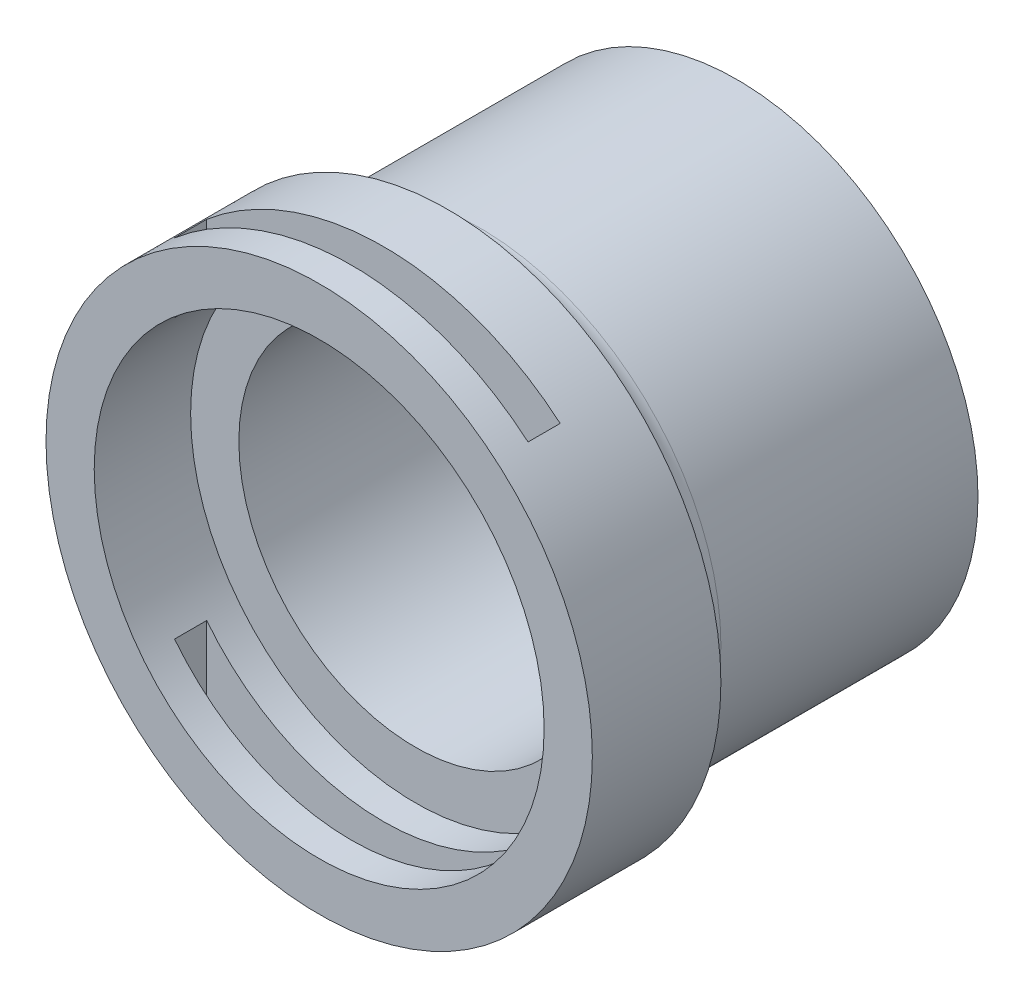
from build123d import *

# Parameters (mm, degrees)
SKETCH1_R                = 15
BOSS_EXTRUDE5_DEPTH      = 26
SKETCH3_R                = 5.625
CUT_EXTRUDE2_DEPTH       = 34.555923471
CUT_EXTRUDE3_DEPTH       = 28
CUT_EXTRUDE3_DEPTH_BACK  = 20
SKETCH4_R                = 11
CUT_EXTRUDE6_START       = 6
SKETCH7_R                = 11
SKETCH7_R_2              = 9
CUT_EXTRUDE6_DEPTH       = 2
BOSS_EXTRUDE8_DEPTH      = 6
BOSS_EXTRUDE8_DEPTH_BACK = 2
BOSS_EXTRUDE8_START      = 20
SKETCH12_R               = 17
CUT_EXTRUDE10_START      = 18
SKETCH13_R               = 11
CUT_EXTRUDE10_DEPTH      = 18.411862419
FILLET2_R                = 2
CUT_EXTRUDE11_START      = 26
SKETCH14_R               = 14
CUT_EXTRUDE11_DEPTH      = 6
SKETCH15_R               = 0.5
CUT_EXTRUDE14_DEPTH      = 36.411862419
CUT_EXTRUDE15_DEPTH      = 36.411862419
CUT_EXTRUDE15_DEPTH_BACK = 36.411862419
SKETCH18_W               = 22
SKETCH18_H               = 2


with BuildPart() as part:
    # Sketch1 → Boss-Extrude5 (new body)
    with BuildSketch(Plane.XY):
        Circle(SKETCH1_R)
    extrude(amount=BOSS_EXTRUDE5_DEPTH)

    # Sketch3 → Cut-Extrude2 (cut, through all)
    with BuildSketch(Plane.XY.offset(26)):
        Circle(SKETCH3_R)
    extrude(amount=-CUT_EXTRUDE2_DEPTH, mode=Mode.SUBTRACT)

    # Sketch4 → Cut-Extrude3 (cut, two sides: drawn at the far end of the back side and taken through both)
    with BuildSketch(Plane.XY.offset(26).offset(-CUT_EXTRUDE3_DEPTH_BACK)):
        Circle(SKETCH4_R)
    extrude(amount=CUT_EXTRUDE3_DEPTH + CUT_EXTRUDE3_DEPTH_BACK, mode=Mode.SUBTRACT)

    # Sketch7 → Cut-Extrude6 (cut)
    with BuildSketch(Plane.XY.offset(CUT_EXTRUDE6_START)):
        Circle(SKETCH7_R)
        Circle(SKETCH7_R_2, mode=Mode.SUBTRACT)
    extrude(amount=-CUT_EXTRUDE6_DEPTH, mode=Mode.SUBTRACT)

    # Sketch12 → Boss-Extrude8 (add, two sides: drawn at the far end of the back side and taken through both)
    with BuildSketch(Plane.XY.offset(BOSS_EXTRUDE8_START - BOSS_EXTRUDE8_DEPTH_BACK)):
        Circle(SKETCH12_R)
    extrude(amount=BOSS_EXTRUDE8_DEPTH + BOSS_EXTRUDE8_DEPTH_BACK)

    # Sketch13 → Cut-Extrude10 (cut, through all)
    with BuildSketch(Plane.XY.offset(CUT_EXTRUDE10_START)):
        Circle(SKETCH13_R)
    extrude(amount=CUT_EXTRUDE10_DEPTH, mode=Mode.SUBTRACT)

    # Fillet2
    fillet2_edges = [part.edges().sort_by_distance(p)[0] for p in [
        (-15, 0, 18),
    ]]
    fillet(fillet2_edges, radius=FILLET2_R - 0.0001)  # a hair under: the kernel refuses the full size

    # Sketch14 → Cut-Extrude11 (cut)
    with BuildSketch(Plane.XY.offset(CUT_EXTRUDE11_START)):
        Circle(SKETCH14_R)
    extrude(amount=-CUT_EXTRUDE11_DEPTH, mode=Mode.SUBTRACT)

    # Sketch15 → Cut-Extrude14 (cut, through all)
    with BuildSketch(Plane.XY):
        with Locations((0, 10)):
            Circle(SKETCH15_R)
        with Locations((0, -10)):
            Circle(SKETCH15_R)
        with Locations((10, 0)):
            Circle(SKETCH15_R)
        with Locations((-10, 0)):
            Circle(SKETCH15_R)
    extrude(amount=CUT_EXTRUDE14_DEPTH, mode=Mode.SUBTRACT)

    # Sketch18 → Cut-Extrude15 (cut, two sides: drawn at the far end of the back side and taken through both)
    with BuildSketch(Plane(origin=(0, 0, 0), x_dir=(1, 0, 0), z_dir=(0, 1, 0)).offset(-CUT_EXTRUDE15_DEPTH_BACK)):
        with Locations((0, -23)):
            Rectangle(SKETCH18_W, SKETCH18_H)
    extrude(amount=CUT_EXTRUDE15_DEPTH + CUT_EXTRUDE15_DEPTH_BACK, mode=Mode.SUBTRACT)


solid = part.part
